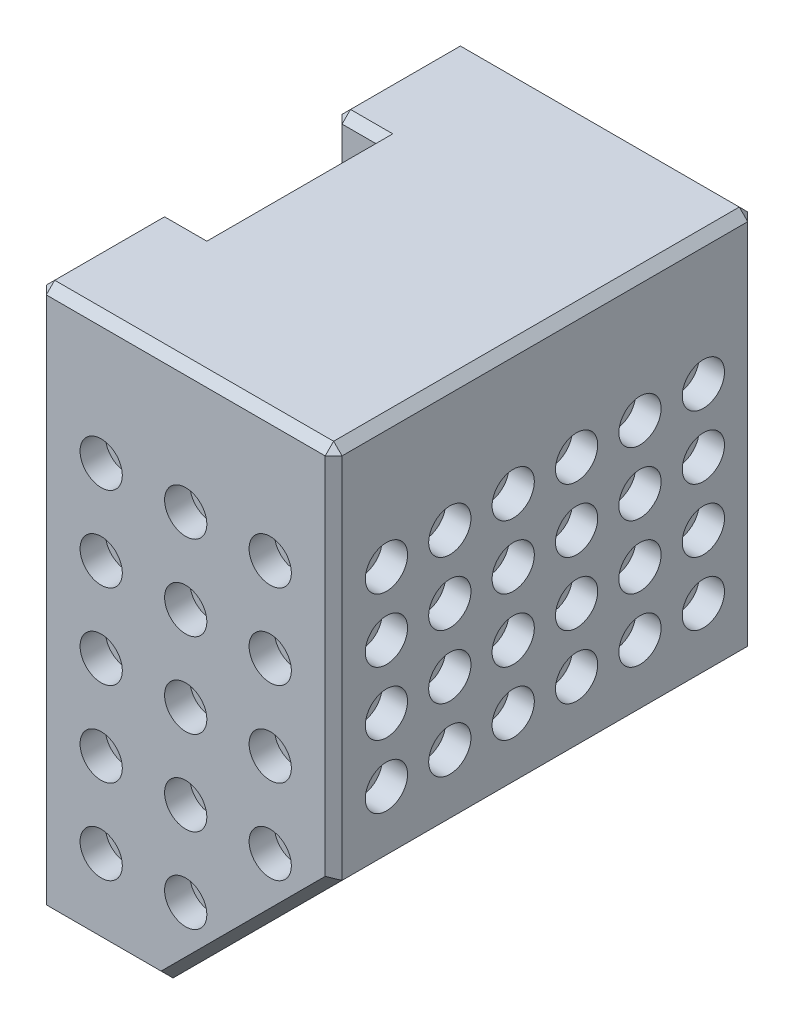
from build123d import *

# Parameters (mm, degrees)
SKETCH1_W            = 35
SKETCH1_H            = 50
BOSS_EXTRUDE1_DEPTH  = 64.5
CUT_EXTRUDE1_REACH   = 85.466
CUT_EXTRUDE2_REACH   = 79.526
SKETCH3_W            = 14
SKETCH3_H            = 20
FILLET1_R            = 7
SKETCH4_W            = 5
SKETCH4_H            = 20
CUT_EXTRUDE3_DEPTH   = 43
SKETCH5_W            = 30
SKETCH5_H            = 5
CUT_EXTRUDE4_DEPTH   = 5
FILLET5_R            = 2.5
FILLET6_R            = 2.5
SKETCH6_R            = 2.5
CUT_EXTRUDE5_DEPTH   = 3
LPATTERN1_COUNT      = 3
LPATTERN1_PITCH      = 10
LPATTERN1_COUNT_DIR2 = 5
LPATTERN1_PITCH_DIR2 = 10
SKETCH9_R            = 2.5
CUT_EXTRUDE20_DEPTH  = 3
LPATTERN2_COUNT      = 4
LPATTERN2_PITCH      = 7.5
LPATTERN2_COUNT_DIR2 = 6
LPATTERN2_PITCH_DIR2 = 7.5
SKETCH10_R           = 2.5
CUT_EXTRUDE21_DEPTH  = 3
LPATTERN3_COUNT      = 7
LPATTERN3_PITCH      = 7.5
LPATTERN3_COUNT_DIR2 = 2
LPATTERN3_PITCH_DIR2 = 35
SKETCH11_R           = 2.5
CUT_EXTRUDE23_DEPTH  = 3
LPATTERN5_COUNT      = 6
LPATTERN5_PITCH      = 7.5
LPATTERN5_COUNT_DIR2 = 3
LPATTERN5_PITCH_DIR2 = 7.5
CUT_EXTRUDE25_START  = -3
SKETCH18_R           = 2.5
CUT_EXTRUDE25_DEPTH  = 3
LPATTERN7_COUNT      = 3
LPATTERN7_PITCH      = 10
LPATTERN7_COUNT_DIR2 = 5
LPATTERN7_PITCH_DIR2 = 10


# Some blends are built 0.0001 mm under size
with BuildPart() as part:
    # Sketch1 → Boss-Extrude1 (new body)
    with BuildSketch(Plane(origin=(0, 0, 0), x_dir=(1, 0, 0), z_dir=(0, 1, 0))):
        Rectangle(SKETCH1_W, SKETCH1_H)
    extrude(amount=-BOSS_EXTRUDE1_DEPTH)

    # Sketch2 → Cut-Extrude1 (cut, up to next)
    with BuildSketch(Plane.XY.offset(25), mode=Mode.PRIVATE) as cut_extrude1_sk1:
        Polygon((-2.5, -64.5), (17.5, -44.5), (17.5, -64.5), align=None)
    cut_extrude1_tool1 = extrude(cut_extrude1_sk1.sketch, amount=-CUT_EXTRUDE1_REACH, mode=Mode.PRIVATE) & part.part
    add(cut_extrude1_tool1.solids().sort_by_distance((10.833333, -57.833333, 25))[0], mode=Mode.SUBTRACT)

    # Sketch3 → Cut-Extrude2 (cut, up to next)
    with BuildSketch(Plane.ZY.offset(17.5), mode=Mode.PRIVATE) as cut_extrude2_sk1:
        with Locations((0, -54.5)):
            Rectangle(SKETCH3_W, SKETCH3_H)
    cut_extrude2_tool1 = extrude(cut_extrude2_sk1.sketch, amount=-CUT_EXTRUDE2_REACH, mode=Mode.PRIVATE) & part.part
    add(cut_extrude2_tool1.solids().sort_by_distance((-17.5, -54.5, 0))[0], mode=Mode.SUBTRACT)

    # Fillet1
    fillet1_edges = [part.edges().sort_by_distance(p)[0] for p in [
        (0, -44.5, -7),
        (0, -44.5, 7),
    ]]
    fillet(fillet1_edges, radius=FILLET1_R - 0.0001)  # a hair under: the kernel refuses the full size

    # Sketch4 → Cut-Extrude3 (cut)
    with BuildSketch(Plane(origin=(0, 0, 0), x_dir=(1, 0, 0), z_dir=(0, 1, 0))):
        with Locations((-15, 0)):
            Rectangle(SKETCH4_W, SKETCH4_H)
    extrude(amount=-CUT_EXTRUDE3_DEPTH, mode=Mode.SUBTRACT)

    # Sketch5 → Cut-Extrude4 (cut)
    with BuildSketch(Plane.ZY.offset(17.5)):
        with Locations((0, -40.5)):
            Rectangle(SKETCH5_W, SKETCH5_H)
    extrude(amount=-CUT_EXTRUDE4_DEPTH, mode=Mode.SUBTRACT)

    # Fillet5
    fillet5_edges = [part.edges().sort_by_distance(p)[0] for p in [
        (-15, -38, -15),
        (-15, -43, -15),
    ]]
    fillet(fillet5_edges, radius=FILLET5_R - 0.0001)  # a hair under: the kernel refuses the full size

    # Fillet6
    fillet6_edges = [part.edges().sort_by_distance(p)[0] for p in [
        (-15, -43, 15),
        (-15, -38, 15),
    ]]
    fillet(fillet6_edges, radius=FILLET6_R - 0.0001)  # a hair under: the kernel refuses the full size

    # Chamfer1
    # the kernel refuses this chamfer: 1 mm, written as the material it takes off along each edge
    with BuildSketch(Plane(origin=(-16.833333333, -63.833333333, -24.333333333), x_dir=(0.7071067811865475, -0.7071067811865475, 0), z_dir=(-0.5773502691896258, -0.5773502691896258, -0.5773502691896258)), Plane(origin=(16.833333333, -0.666666667, -24.333333333), x_dir=(0, -0.7071067811865475, -0.7071067811865476), z_dir=(0.5773502691896257, 0.5773502691896258, -0.5773502691896257)), Plane(origin=(-16.833333333, -63.833333333, 24.333333333), x_dir=(0.7071067811865475, 0, 0.7071067811865475), z_dir=(-0.5773502691896258, -0.5773502691896258, 0.5773502691896258)), Plane(origin=(-16.833333333, -0.666666667, 24.333333333), x_dir=(0.7071067811865476, 0.7071067811865475, 0), z_dir=(-0.5773502691896257, 0.5773502691896258, 0.5773502691896257)), Plane(origin=(-16.833333333, -0.666666667, 10.666666667), x_dir=(0.7071067811865457, 0, -0.7071067811865493), z_dir=(-0.5773502691896271, 0.5773502691896262, -0.5773502691896241))) as chamfer1_piece_1:
        Polygon((-0.707106781, 0.40824829), (0.707106781, 0.40824829), (0, -0.816496581), align=None)
    extrude(amount=1.270170592, mode=Mode.SUBTRACT)
    with BuildSketch(Plane(origin=(16.833333333, -0.666666667, 24.333333333), x_dir=(0, -0.7071067811865475, 0.7071067811865476), z_dir=(0.5773502691896257, 0.5773502691896258, 0.5773502691896257)), Plane(origin=(-16.833333333, -0.666666667, -24.333333333), x_dir=(0.7071067811865476, 0.7071067811865475, 0), z_dir=(-0.5773502691896257, 0.5773502691896258, -0.5773502691896257)), Plane(origin=(-16.833333333, -0.666666667, -10.666666667), x_dir=(0.7071067811865464, 0, 0.7071067811865488), z_dir=(-0.5773502691896264, 0.5773502691896265, 0.5773502691896244))) as chamfer1_piece_2:
        Polygon((-0.707106781, -0.40824829), (0.707106781, -0.40824829), (0, 0.816496581), align=None)
    extrude(amount=1.270170592, mode=Mode.SUBTRACT)
    with BuildSketch(Plane(origin=(-17.5, -40.4999, -15), x_dir=(-0.027495876610585647, 0, -0.9996219169112968), z_dir=(0, -1, 0)), Plane(origin=(-17.5, -40.5001, 15), x_dir=(-0.027495876610585647, 0, 0.9996219169112968), z_dir=(0, 1, 0)), Plane(origin=(-17.5, -44.5, 0.0001), x_dir=(-0.02749587661058555, 0.9996219169112968, 0), z_dir=(0, 0, -1))) as chamfer1_piece_3:
        with BuildLine():
            Line((1.028673195, 0), (-0.056547155, 1.027117794))
            Line((-0.056547155, 1.027117794), (-0.076539593, 1.026567876))
            ThreePointArc((-0.076539593, 1.026567876), (-0.034129227, 0.51339783), (-0.019992438, -0.000549918))
            Line((-0.019992438, -0.000549918), (0.000549918, -0.019992438))
            ThreePointArc((0.000549918, -0.019992438), (0.514497665, -0.00585565), (1.029223113, -0.019992438))
            Line((1.029223113, -0.019992438), (1.028673195, 0))
        make_face()
    extrude(amount=0.0002, mode=Mode.SUBTRACT)
    with BuildSketch(Plane(origin=(-17.5, -38, 12.5001), x_dir=(-0.02749587661058555, 0.9996219169112968, 0), z_dir=(0, 0, -1)), Plane(origin=(-17.5, -38, -7.428317012), x_dir=(-0.02749587661058555, 0.9996219169112968, 0), z_dir=(0, 0, -1))) as chamfer1_piece_4:
        with BuildLine():
            Line((1.028673195, 0), (-0.056547155, 1.027117794))
            Line((-0.056547155, 1.027117794), (-0.076539593, 1.026567876))
            ThreePointArc((-0.076539593, 1.026567876), (-0.034129227, 0.51339783), (-0.019992438, -0.000549918))
            Line((-0.019992438, -0.000549918), (0.000549918, -0.019992438))
            ThreePointArc((0.000549918, -0.019992438), (0.514497665, -0.00585565), (1.029223113, -0.019992438))
            Line((1.029223113, -0.019992438), (1.028673195, 0))
        make_face()
    extrude(amount=5.071782988, mode=Mode.SUBTRACT)
    with BuildSketch(Plane(origin=(-17.5, -64.5, -27.571682988), x_dir=(-0.02749587661058555, 0.9996219169112968, 0), z_dir=(0, 0, 1)), Plane(origin=(-17.5, -64.5, 4.428317012), x_dir=(-0.02749587661058555, 0.9996219169112968, 0), z_dir=(0, 0, 1))) as chamfer1_piece_5:
        with BuildLine():
            Line((1.028673195, 0), (-0.056547155, -1.027117794))
            Line((-0.056547155, -1.027117794), (-0.076539593, -1.026567876))
            ThreePointArc((-0.076539593, -1.026567876), (-0.034129227, -0.51339783), (-0.019992438, 0.000549918))
            Line((-0.019992438, 0.000549918), (0.000549918, 0.019992438))
            ThreePointArc((0.000549918, 0.019992438), (0.514497665, 0.00585565), (1.029223113, 0.019992438))
            Line((1.029223113, 0.019992438), (1.028673195, 0))
        make_face()
    extrude(amount=23.143365976, mode=Mode.SUBTRACT)
    with BuildSketch(Plane(origin=(0.071682988, -64.5, -25), x_dir=(0, 0.9996219169112968, -0.02749587661058555), z_dir=(-1, 0, 0)), Plane(origin=(-20.071682988, -64.5, 25), x_dir=(0, 0.9996219169112968, 0.02749587661058555), z_dir=(1, 0, 0))) as chamfer1_piece_6:
        with BuildLine():
            Line((1.028673195, 0), (-0.056547155, -1.027117794))
            Line((-0.056547155, -1.027117794), (-0.076539593, -1.026567876))
            ThreePointArc((-0.076539593, -1.026567876), (-0.034129227, -0.51339783), (-0.019992438, 0.000549918))
            Line((-0.019992438, 0.000549918), (0.000549918, 0.019992438))
            ThreePointArc((0.000549918, 0.019992438), (0.514497665, 0.00585565), (1.029223113, 0.019992438))
            Line((1.029223113, 0.019992438), (1.028673195, 0))
        make_face()
    extrude(amount=20.143365976, mode=Mode.SUBTRACT)
    with BuildSketch(Plane(origin=(17.5, 2.571682988, -25), x_dir=(-0.9996219169112968, 0, -0.027495876610585647), z_dir=(0, -1, 0))) as chamfer1_piece_7:
        with BuildLine():
            Line((1.028673195, 0), (-0.056547155, -1.027117794))
            Line((-0.056547155, -1.027117794), (-0.076539593, -1.026567876))
            ThreePointArc((-0.076539593, -1.026567876), (-0.034129227, -0.51339783), (-0.019992438, 0.000549918))
            Line((-0.019992438, 0.000549918), (0.000549918, 0.019992438))
            ThreePointArc((0.000549918, 0.019992438), (0.514497665, 0.00585565), (1.029223113, 0.019992438))
            Line((1.029223113, 0.019992438), (1.028673195, 0))
        make_face()
    extrude(amount=49.643365976, mode=Mode.SUBTRACT)
    with BuildSketch(Plane(origin=(17.5, 2.571682988, 25), x_dir=(-0.9996219169112968, 0, 0.027495876610585647), z_dir=(0, -1, 0))) as chamfer1_piece_8:
        with BuildLine():
            Line((1.028673195, 0), (-0.056547155, 1.027117794))
            Line((-0.056547155, 1.027117794), (-0.076539593, 1.026567876))
            ThreePointArc((-0.076539593, 1.026567876), (-0.034129227, 0.51339783), (-0.019992438, -0.000549918))
            Line((-0.019992438, -0.000549918), (0.000549918, -0.019992438))
            ThreePointArc((0.000549918, -0.019992438), (0.514497665, -0.00585565), (1.029223113, -0.019992438))
            Line((1.029223113, -0.019992438), (1.028673195, 0))
        make_face()
    extrude(amount=49.643365976, mode=Mode.SUBTRACT)
    with BuildSketch(Plane(origin=(-4.31845448, -66.31845448, -25), x_dir=(-0.7068394360706697, 0.7068394360706772, -0.027495876610585696), z_dir=(0.7071067811865513, 0.7071067811865438, 0))) as chamfer1_piece_9:
        with BuildLine():
            Line((1.028673195, 0), (-0.056547155, 1.027117794))
            Line((-0.056547155, 1.027117794), (-0.076539593, 1.026567876))
            ThreePointArc((-0.076539593, 1.026567876), (-0.034129227, 0.51339783), (-0.019992438, -0.000549918))
            Line((-0.019992438, -0.000549918), (0.000549918, -0.019992438))
            ThreePointArc((0.000549918, -0.019992438), (0.514497665, -0.00585565), (1.029223113, -0.019992438))
            Line((1.029223113, -0.019992438), (1.028673195, 0))
        make_face()
    extrude(amount=33.427637223, mode=Mode.SUBTRACT)
    with BuildSketch(Plane(origin=(-4.31845448, -66.31845448, 25), x_dir=(-0.7068394360706697, 0.7068394360706772, 0.027495876610585696), z_dir=(0.7071067811865513, 0.7071067811865438, 0))) as chamfer1_piece_10:
        with BuildLine():
            Line((1.028673195, 0), (-0.056547155, -1.027117794))
            Line((-0.056547155, -1.027117794), (-0.076539593, -1.026567876))
            ThreePointArc((-0.076539593, -1.026567876), (-0.034129227, -0.51339783), (-0.019992438, 0.000549918))
            Line((-0.019992438, 0.000549918), (0.000549918, 0.019992438))
            ThreePointArc((0.000549918, 0.019992438), (0.514497665, 0.00585565), (1.029223113, 0.019992438))
            Line((1.029223113, 0.019992438), (1.028673195, 0))
        make_face()
    extrude(amount=33.427637223, mode=Mode.SUBTRACT)
    with BuildSketch(Plane(origin=(-17.5, -67.071682988, 7), x_dir=(-0.027495876610585647, 0, 0.9996219169112968), z_dir=(0, 1, 0)), Plane(origin=(-17.5, -51.4999, -7), x_dir=(-0.027495876610585647, 0, -0.9996219169112968), z_dir=(0, -1, 0))) as chamfer1_piece_11:
        with BuildLine():
            Line((1.028673195, 0), (-0.056547155, 1.027117794))
            Line((-0.056547155, 1.027117794), (-0.076539593, 1.026567876))
            ThreePointArc((-0.076539593, 1.026567876), (-0.034129227, 0.51339783), (-0.019992438, -0.000549918))
            Line((-0.019992438, -0.000549918), (0.000549918, -0.019992438))
            ThreePointArc((0.000549918, -0.019992438), (0.514497665, -0.00585565), (1.029223113, -0.019992438))
            Line((1.029223113, -0.019992438), (1.028673195, 0))
        make_face()
    extrude(amount=15.571782988, mode=Mode.SUBTRACT)
    with BuildSketch(Plane(origin=(-20.071682988, 0, 25), x_dir=(0, 0.02749587661058639, -0.9996219169112968), z_dir=(1, 0, 0)), Plane(origin=(20.071682988, 0, -25), x_dir=(0, 0.02749587661058639, 0.9996219169112968), z_dir=(-1, 0, 0))) as chamfer1_piece_12:
        with BuildLine():
            Line((1.028673195, 0), (-0.056547155, -1.027117794))
            Line((-0.056547155, -1.027117794), (-0.076539593, -1.026567876))
            ThreePointArc((-0.076539593, -1.026567876), (-0.034129227, -0.51339783), (-0.019992438, 0.000549918))
            Line((-0.019992438, 0.000549918), (0.000549918, 0.019992438))
            ThreePointArc((0.000549918, 0.019992438), (0.514497665, 0.00585565), (1.029223113, 0.019992438))
            Line((1.029223113, 0.019992438), (1.028673195, 0))
        make_face()
    extrude(amount=40.143365976, mode=Mode.SUBTRACT)
    with BuildSketch(Plane(origin=(-17.5, 0, -27.571682988), x_dir=(-0.02749587661058563, -0.9996219169112968, 0), z_dir=(0, 0, 1)), Plane(origin=(-17.5, 0, 7.428317012), x_dir=(-0.02749587661058563, -0.9996219169112968, 0), z_dir=(0, 0, 1))) as chamfer1_piece_13:
        with BuildLine():
            Line((1.028673195, 0), (-0.056547155, 1.027117794))
            Line((-0.056547155, 1.027117794), (-0.076539593, 1.026567876))
            ThreePointArc((-0.076539593, 1.026567876), (-0.034129227, 0.51339783), (-0.019992438, -0.000549918))
            Line((-0.019992438, -0.000549918), (0.000549918, -0.019992438))
            ThreePointArc((0.000549918, -0.019992438), (0.514497665, -0.00585565), (1.029223113, -0.019992438))
            Line((1.029223113, -0.019992438), (1.028673195, 0))
        make_face()
    extrude(amount=20.143365976, mode=Mode.SUBTRACT)
    with BuildSketch(Plane(origin=(17.5, 0, 27.571682988), x_dir=(-0.9996219169112968, 0.02749587661058639, 0), z_dir=(0, 0, -1))) as chamfer1_piece_14:
        with BuildLine():
            Line((1.028673195, 0), (-0.056547155, -1.027117794))
            Line((-0.056547155, -1.027117794), (-0.076539593, -1.026567876))
            ThreePointArc((-0.076539593, -1.026567876), (-0.034129227, -0.51339783), (-0.019992438, 0.000549918))
            Line((-0.019992438, 0.000549918), (0.000549918, 0.019992438))
            ThreePointArc((0.000549918, 0.019992438), (0.514497665, 0.00585565), (1.029223113, 0.019992438))
            Line((1.029223113, 0.019992438), (1.028673195, 0))
        make_face()
    extrude(amount=55.143365976, mode=Mode.SUBTRACT)
    with BuildSketch(Plane(origin=(-20.071682988, 0, 10), x_dir=(0, -0.9996219169112968, -0.02749587661058563), z_dir=(1, 0, 0)), Plane(origin=(-12.5, 0, -10), x_dir=(0, -0.9996219169112968, 0.02749587661058563), z_dir=(-1, 0, 0))) as chamfer1_piece_15:
        with BuildLine():
            Line((1.028673195, 0), (-0.056547155, -1.027117794))
            Line((-0.056547155, -1.027117794), (-0.076539593, -1.026567876))
            ThreePointArc((-0.076539593, -1.026567876), (-0.034129227, -0.51339783), (-0.019992438, 0.000549918))
            Line((-0.019992438, 0.000549918), (0.000549918, 0.019992438))
            ThreePointArc((0.000549918, 0.019992438), (0.514497665, 0.00585565), (1.029223113, 0.019992438))
            Line((1.029223113, 0.019992438), (1.028673195, 0))
        make_face()
    extrude(amount=7.571682988, mode=Mode.SUBTRACT)
    with BuildSketch(Plane(origin=(-12.5, 0, 10), x_dir=(0.9996219169112968, 0.02749587661058639, 0), z_dir=(0, 0, -1))) as chamfer1_piece_16:
        with BuildLine():
            Line((1.028673195, 0), (-0.056547155, 1.027117794))
            Line((-0.056547155, 1.027117794), (-0.076539593, 1.026567876))
            ThreePointArc((-0.076539593, 1.026567876), (-0.034129227, 0.51339783), (-0.019992438, -0.000549918))
            Line((-0.019992438, -0.000549918), (0.000549918, -0.019992438))
            ThreePointArc((0.000549918, -0.019992438), (0.514497665, -0.00585565), (1.029223113, -0.019992438))
            Line((1.029223113, -0.019992438), (1.028673195, 0))
        make_face()
    extrude(amount=20, mode=Mode.SUBTRACT)
    with BuildSketch(Plane(origin=(-17.5, 2.571682988, 10), x_dir=(-0.027495876610585647, 0, 0.9996219169112968), z_dir=(0, -1, 0))) as chamfer1_piece_17:
        with BuildLine():
            Line((1.028673195, 0), (-0.056547155, -1.027117794))
            Line((-0.056547155, -1.027117794), (-0.076539593, -1.026567876))
            ThreePointArc((-0.076539593, -1.026567876), (-0.034129227, -0.51339783), (-0.019992438, 0.000549918))
            Line((-0.019992438, 0.000549918), (0.000549918, 0.019992438))
            ThreePointArc((0.000549918, 0.019992438), (0.514497665, 0.00585565), (1.029223113, 0.019992438))
            Line((1.029223113, 0.019992438), (1.028673195, 0))
        make_face()
    extrude(amount=43.143365976, mode=Mode.SUBTRACT)
    with BuildSketch(Plane(origin=(-17.5, 2.571682988, -10), x_dir=(-0.027495876610585647, 0, -0.9996219169112968), z_dir=(0, -1, 0))) as chamfer1_piece_18:
        with BuildLine():
            Line((1.028673195, 0), (-0.056547155, 1.027117794))
            Line((-0.056547155, 1.027117794), (-0.076539593, 1.026567876))
            ThreePointArc((-0.076539593, 1.026567876), (-0.034129227, 0.51339783), (-0.019992438, -0.000549918))
            Line((-0.019992438, -0.000549918), (0.000549918, -0.019992438))
            ThreePointArc((0.000549918, -0.019992438), (0.514497665, -0.00585565), (1.029223113, -0.019992438))
            Line((1.029223113, -0.019992438), (1.028673195, 0))
        make_face()
    extrude(amount=43.143365976, mode=Mode.SUBTRACT)
    with BuildSketch(Plane(origin=(-17.5, 2.571682988, 25), x_dir=(-0.027495876610585647, 0, -0.9996219169112968), z_dir=(0, -1, 0))) as chamfer1_piece_19:
        with BuildLine():
            Line((1.028673195, 0), (-0.056547155, 1.027117794))
            Line((-0.056547155, 1.027117794), (-0.076539593, 1.026567876))
            ThreePointArc((-0.076539593, 1.026567876), (-0.034129227, 0.51339783), (-0.019992438, -0.000549918))
            Line((-0.019992438, -0.000549918), (0.000549918, -0.019992438))
            ThreePointArc((0.000549918, -0.019992438), (0.514497665, -0.00585565), (1.029223113, -0.019992438))
            Line((1.029223113, -0.019992438), (1.028673195, 0))
        make_face()
    extrude(amount=69.643365976, mode=Mode.SUBTRACT)
    with BuildSketch(Plane(origin=(-17.5, 2.571682988, -25), x_dir=(-0.027495876610585647, 0, 0.9996219169112968), z_dir=(0, -1, 0))) as chamfer1_piece_20:
        with BuildLine():
            Line((1.028673195, 0), (-0.056547155, -1.027117794))
            Line((-0.056547155, -1.027117794), (-0.076539593, -1.026567876))
            ThreePointArc((-0.076539593, -1.026567876), (-0.034129227, -0.51339783), (-0.019992438, 0.000549918))
            Line((-0.019992438, 0.000549918), (0.000549918, 0.019992438))
            ThreePointArc((0.000549918, 0.019992438), (0.514497665, 0.00585565), (1.029223113, 0.019992438))
            Line((1.029223113, 0.019992438), (1.028673195, 0))
        make_face()
    extrude(amount=69.643365976, mode=Mode.SUBTRACT)
    with BuildSketch(Plane(origin=(-17.5, -43, 12.5001), x_dir=(-0.02749587661058555, -0.9996219169112968, 0), z_dir=(0, 0, -1))) as chamfer1_piece_21:
        with BuildLine():
            Line((1.028673195, 0), (-0.056547155, -1.027117794))
            Line((-0.056547155, -1.027117794), (-0.076539593, -1.026567876))
            ThreePointArc((-0.076539593, -1.026567876), (-0.034129227, -0.51339783), (-0.019992438, 0.000549918))
            Line((-0.019992438, 0.000549918), (0.000549918, 0.019992438))
            ThreePointArc((0.000549918, 0.019992438), (0.514497665, 0.00585565), (1.029223113, 0.019992438))
            Line((1.029223113, 0.019992438), (1.028673195, 0))
        make_face()
    extrude(amount=25.0002, mode=Mode.SUBTRACT)
    with BuildSketch(Plane(origin=(-17.5, -40.5001, 12.5001), x_dir=(0, -1, 0), z_dir=(0, 0, -1))) as chamfer1_piece_22:
        with BuildLine():
            Line((3.528184271, 0.028284271), (2.471615729, -1.028284271))
            Line((2.471615729, -1.028284271), (2.451615729, -1.028284271))
            ThreePointArc((2.451615729, -1.028284271), (2.4799, -0.514142136), (2.4799, 0))
            Line((2.4799, 0), (2.4999, 0.02))
            ThreePointArc((2.4999, 0.02), (3.014042136, 0.02), (3.528184271, 0.048284271))
            Line((3.528184271, 0.048284271), (3.528184271, 0.028284271))
        make_face()
    revolve(axis=Axis((-17.5, -40.5001, 12.5001), (-1, 0, 0)), revolution_arc=90, mode=Mode.SUBTRACT)
    with BuildSketch(Plane(origin=(-17.5, -40.5001, -12.5001), x_dir=(0, 0, -1), z_dir=(0, 1, 0))) as chamfer1_piece_23:
        with BuildLine():
            Line((3.528184271, 0.028284271), (2.471615729, -1.028284271))
            Line((2.471615729, -1.028284271), (2.451615729, -1.028284271))
            ThreePointArc((2.451615729, -1.028284271), (2.4799, -0.514142136), (2.4799, 0))
            Line((2.4799, 0), (2.4999, 0.02))
            ThreePointArc((2.4999, 0.02), (3.014042136, 0.02), (3.528184271, 0.048284271))
            Line((3.528184271, 0.048284271), (3.528184271, 0.028284271))
        make_face()
    revolve(axis=Axis((-17.5, -40.5001, -12.5001), (-1, 0, 0)), revolution_arc=90, mode=Mode.SUBTRACT)
    with BuildSketch(Plane(origin=(-17.5, -40.4999, -12.5001), x_dir=(0, 1, 0), z_dir=(0, 0, 1))) as chamfer1_piece_24:
        with BuildLine():
            Line((3.528184271, 0.028284271), (2.471615729, -1.028284271))
            Line((2.471615729, -1.028284271), (2.451615729, -1.028284271))
            ThreePointArc((2.451615729, -1.028284271), (2.4799, -0.514142136), (2.4799, 0))
            Line((2.4799, 0), (2.4999, 0.02))
            ThreePointArc((2.4999, 0.02), (3.014042136, 0.02), (3.528184271, 0.048284271))
            Line((3.528184271, 0.048284271), (3.528184271, 0.028284271))
        make_face()
    revolve(axis=Axis((-17.5, -40.4999, -12.5001), (-1, 0, 0)), revolution_arc=90, mode=Mode.SUBTRACT)
    with BuildSketch(Plane(origin=(-17.5, -51.4999, 0.0001), x_dir=(0, 1, 0), z_dir=(0, 0, -1))) as chamfer1_piece_25:
        with BuildLine():
            Line((8.028184271, -0.028284271), (6.971615729, 1.028284271))
            Line((6.971615729, 1.028284271), (6.951615729, 1.028284271))
            ThreePointArc((6.951615729, 1.028284271), (6.9799, 0.514142136), (6.9799, 0))
            Line((6.9799, 0), (6.9999, -0.02))
            ThreePointArc((6.9999, -0.02), (7.514042136, -0.02), (8.028184271, -0.048284271))
            Line((8.028184271, -0.048284271), (8.028184271, -0.028284271))
        make_face()
    revolve(axis=Axis((-17.5, -51.4999, 0.0001), (1, 0, 0)), revolution_arc=90, mode=Mode.SUBTRACT)
    with BuildSketch(Plane(origin=(-17.5, -51.4999, -0.0001), x_dir=(0, 1, 0), z_dir=(0, 0, 1))) as chamfer1_piece_26:
        with BuildLine():
            Line((8.028184271, 0.028284271), (6.971615729, -1.028284271))
            Line((6.971615729, -1.028284271), (6.951615729, -1.028284271))
            ThreePointArc((6.951615729, -1.028284271), (6.9799, -0.514142136), (6.9799, 0))
            Line((6.9799, 0), (6.9999, 0.02))
            ThreePointArc((6.9999, 0.02), (7.514042136, 0.02), (8.028184271, 0.048284271))
            Line((8.028184271, 0.048284271), (8.028184271, 0.028284271))
        make_face()
    revolve(axis=Axis((-17.5, -51.4999, -0.0001), (-1, 0, 0)), revolution_arc=90, mode=Mode.SUBTRACT)
    with BuildSketch(Plane(origin=(-17.5, -40.4999, 12.5001), x_dir=(0, 0, 1), z_dir=(0, -1, 0))) as chamfer1_piece_27:
        with BuildLine():
            Line((3.528184271, 0.028284271), (2.471615729, -1.028284271))
            Line((2.471615729, -1.028284271), (2.451615729, -1.028284271))
            ThreePointArc((2.451615729, -1.028284271), (2.4799, -0.514142136), (2.4799, 0))
            Line((2.4799, 0), (2.4999, 0.02))
            ThreePointArc((2.4999, 0.02), (3.014042136, 0.02), (3.528184271, 0.048284271))
            Line((3.528184271, 0.048284271), (3.528184271, 0.028284271))
        make_face()
    revolve(axis=Axis((-17.5, -40.4999, 12.5001), (-1, 0, 0)), revolution_arc=90, mode=Mode.SUBTRACT)
    with BuildSketch(Plane(origin=(-20.071682988, 0, 10), x_dir=(0, -0.9996219169112968, -0.02749587661058563), z_dir=(1, 0, 0))) as chamfer1_piece_28a_section:
        with BuildLine():
            Line((1.028673195, 0), (-0.056547155, -1.027117794))
            Line((-0.056547155, -1.027117794), (-0.076539593, -1.026567876))
            ThreePointArc((-0.076539593, -1.026567876), (-0.034129227, -0.51339783), (-0.019992438, 0.000549918))
            Line((-0.019992438, 0.000549918), (0.000549918, 0.019992438))
            ThreePointArc((0.000549918, 0.019992438), (0.514497665, 0.00585565), (1.029223113, 0.019992438))
            Line((1.029223113, 0.019992438), (1.028673195, 0))
        make_face()
    chamfer1_piece_28a = extrude(amount=10.143365976, mode=Mode.PRIVATE)
    chamfer1_piece_28a = split(chamfer1_piece_28a, bisect_by=Plane(origin=(-12.5, -0.329793627, 10.329793627), z_dir=(1, 0, 0)), keep=Keep.TOP, mode=Mode.PRIVATE)
    with BuildSketch(Plane(origin=(-12.5, 0, 12.571682988), x_dir=(0.9996219169112968, 0.02749587661058639, 0), z_dir=(0, 0, -1))) as chamfer1_piece_28b_section:
        with BuildLine():
            Line((1.028673195, 0), (-0.056547155, 1.027117794))
            Line((-0.056547155, 1.027117794), (-0.076539593, 1.026567876))
            ThreePointArc((-0.076539593, 1.026567876), (-0.034129227, 0.51339783), (-0.019992438, -0.000549918))
            Line((-0.019992438, -0.000549918), (0.000549918, -0.019992438))
            ThreePointArc((0.000549918, -0.019992438), (0.514497665, -0.00585565), (1.029223113, -0.019992438))
            Line((1.029223113, -0.019992438), (1.028673195, 0))
        make_face()
    chamfer1_piece_28b = extrude(amount=22.571682988, mode=Mode.PRIVATE)
    chamfer1_piece_28b = split(chamfer1_piece_28b, bisect_by=Plane(origin=(-12.170206373, -0.329793627, 10), z_dir=(0, 0, 1)), keep=Keep.TOP, mode=Mode.PRIVATE)
    chamfer1_piece_28 = chamfer1_piece_28a & chamfer1_piece_28b
    add(chamfer1_piece_28, mode=Mode.SUBTRACT)
    with BuildSketch(Plane(origin=(-9.928317012, 0, -10), x_dir=(0, -0.9996219169112968, 0.02749587661058563), z_dir=(-1, 0, 0))) as chamfer1_piece_29a_section:
        with BuildLine():
            Line((1.028673195, 0), (-0.056547155, -1.027117794))
            Line((-0.056547155, -1.027117794), (-0.076539593, -1.026567876))
            ThreePointArc((-0.076539593, -1.026567876), (-0.034129227, -0.51339783), (-0.019992438, 0.000549918))
            Line((-0.019992438, 0.000549918), (0.000549918, 0.019992438))
            ThreePointArc((0.000549918, 0.019992438), (0.514497665, 0.00585565), (1.029223113, 0.019992438))
            Line((1.029223113, 0.019992438), (1.028673195, 0))
        make_face()
    chamfer1_piece_29a = extrude(amount=10.143365976, mode=Mode.PRIVATE)
    chamfer1_piece_29a = split(chamfer1_piece_29a, bisect_by=Plane(origin=(-12.5, -0.329793627, -10.329793627), z_dir=(1, 0, 0)), keep=Keep.TOP, mode=Mode.PRIVATE)
    with BuildSketch(Plane(origin=(-12.5, 0, 10), x_dir=(0.9996219169112968, 0.02749587661058639, 0), z_dir=(0, 0, -1))) as chamfer1_piece_29b_section:
        with BuildLine():
            Line((1.028673195, 0), (-0.056547155, 1.027117794))
            Line((-0.056547155, 1.027117794), (-0.076539593, 1.026567876))
            ThreePointArc((-0.076539593, 1.026567876), (-0.034129227, 0.51339783), (-0.019992438, -0.000549918))
            Line((-0.019992438, -0.000549918), (0.000549918, -0.019992438))
            ThreePointArc((0.000549918, -0.019992438), (0.514497665, -0.00585565), (1.029223113, -0.019992438))
            Line((1.029223113, -0.019992438), (1.028673195, 0))
        make_face()
    chamfer1_piece_29b = extrude(amount=22.571682988, mode=Mode.PRIVATE)
    chamfer1_piece_29b = split(chamfer1_piece_29b, bisect_by=Plane(origin=(-12.170206373, -0.329793627, -10), z_dir=(0, 0, -1)), keep=Keep.TOP, mode=Mode.PRIVATE)
    chamfer1_piece_29 = chamfer1_piece_29a & chamfer1_piece_29b
    add(chamfer1_piece_29, mode=Mode.SUBTRACT)

    # Sketch6 → Cut-Extrude5 (cut)
    with BuildSketch(Plane.XY.offset(25)):
        with Locations((-10, -15)):
            Circle(SKETCH6_R)
    cut_extrude5 = extrude(amount=-CUT_EXTRUDE5_DEPTH, mode=Mode.SUBTRACT)

    # LPattern1: Cut-Extrude5 3 × 5, 1 skipped
    with Locations(*[(i * LPATTERN1_PITCH, -j * LPATTERN1_PITCH_DIR2, 0) for i in range(LPATTERN1_COUNT) for j in range(LPATTERN1_COUNT_DIR2) if (i, j) not in ((0, 0), (2, 4))]):
        add(cut_extrude5, mode=Mode.SUBTRACT)

    # Sketch9 → Cut-Extrude20 (cut)
    with BuildSketch(Plane(origin=(17.5, 0, 0), x_dir=(0, 0, -1), z_dir=(1, 0, 0))):
        with Locations((-18.75, -15)):
            Circle(SKETCH9_R)
    cut_extrude20 = extrude(amount=-CUT_EXTRUDE20_DEPTH, mode=Mode.SUBTRACT)

    # LPattern2: Cut-Extrude20 4 × 6
    with Locations(*[(0, -i * LPATTERN2_PITCH, -j * LPATTERN2_PITCH_DIR2) for i in range(LPATTERN2_COUNT) for j in range(LPATTERN2_COUNT_DIR2) if (i, j) != (0, 0)]):
        add(cut_extrude20, mode=Mode.SUBTRACT)

    # Sketch10 → Cut-Extrude21 (cut)
    with BuildSketch(Plane.ZY.offset(17.5)):
        with Locations((-17.5, -15)):
            Circle(SKETCH10_R)
    cut_extrude21 = extrude(amount=-CUT_EXTRUDE21_DEPTH, mode=Mode.SUBTRACT)

    # LPattern3: Cut-Extrude21 7 × 2
    with Locations(*[(0, -i * LPATTERN3_PITCH, j * LPATTERN3_PITCH_DIR2) for i in range(LPATTERN3_COUNT) for j in range(LPATTERN3_COUNT_DIR2) if (i, j) != (0, 0)]):
        add(cut_extrude21, mode=Mode.SUBTRACT)

    # Sketch11 → Cut-Extrude23 (cut)
    with BuildSketch(Plane(origin=(31, -31, 0), x_dir=(0, 0, -1), z_dir=(0.707106781186544, -0.7071067811865511, 0))):
        with Locations(Location((-18.75, -26.591883092, 0), (0, 0, 90))):
            Circle(SKETCH11_R)
    cut_extrude23 = extrude(amount=-CUT_EXTRUDE23_DEPTH, mode=Mode.SUBTRACT)

    # LPattern5: Cut-Extrude23 6 × 3, 6 skipped
    with Locations(*[Vector(0, 0, -1) * (i * LPATTERN5_PITCH) + Vector(-0.707106781186551, -0.707106781186544, 0) * (j * LPATTERN5_PITCH_DIR2) for i in range(LPATTERN5_COUNT) for j in range(LPATTERN5_COUNT_DIR2) if (i, j) not in ((0, 0), (2, 0), (2, 1), (2, 2), (3, 0), (3, 1), (3, 2))]):
        add(cut_extrude23, mode=Mode.SUBTRACT)

    # Sketch18 → Cut-Extrude25 (cut)
    with BuildSketch(Plane(origin=(0, 0, -25), x_dir=(-1, 0, 0), z_dir=(0, 0, -1)).offset(CUT_EXTRUDE25_START)):
        with Locations(Location((10, -15, 0), (0, 0, 180))):
            Circle(SKETCH18_R)
    cut_extrude25 = extrude(amount=CUT_EXTRUDE25_DEPTH, mode=Mode.SUBTRACT)

    # LPattern7: Cut-Extrude25 3 × 5
    with Locations(*[(i * LPATTERN7_PITCH, -j * LPATTERN7_PITCH_DIR2, 0) for i in range(LPATTERN7_COUNT) for j in range(LPATTERN7_COUNT_DIR2) if (i, j) != (0, 0)]):
        add(cut_extrude25, mode=Mode.SUBTRACT)


solid = part.part
